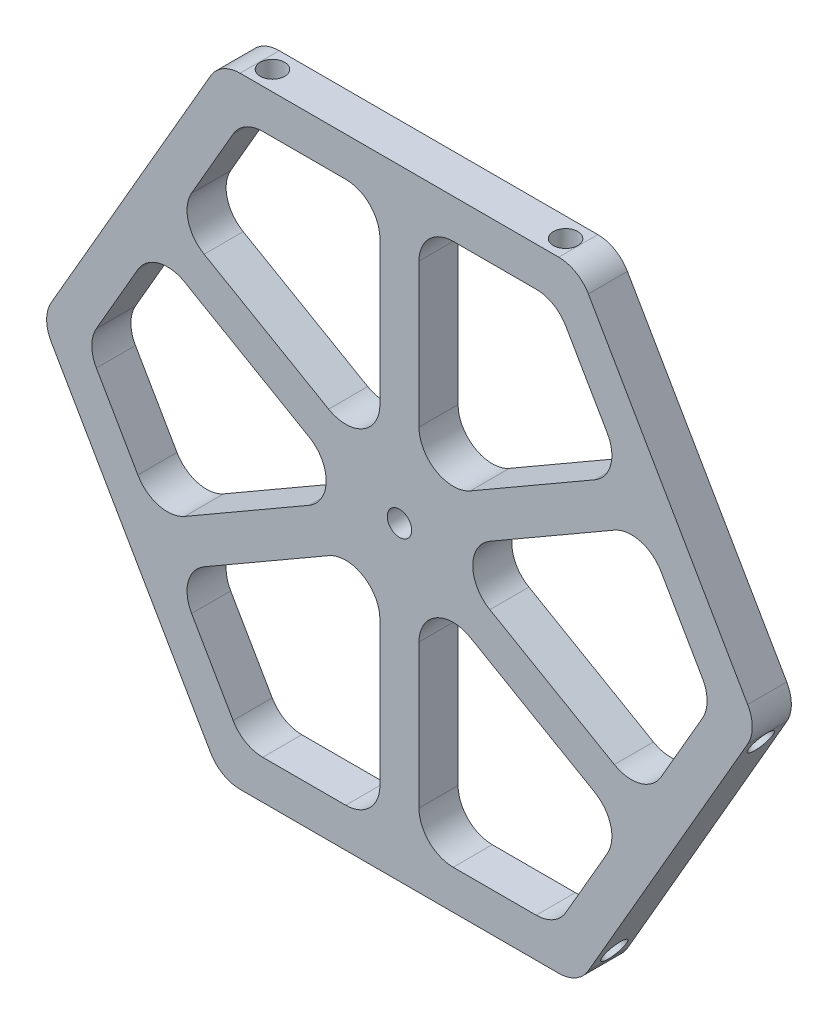
from build123d import *

# Parameters (mm, degrees)
SKETCH1_R              = 1.25
BOSS_EXTRUDE4_DEPTH    = 4
FILLET1_R              = 3.5
CUT_EXTRUDE1_START     = -31.73871501
CUT_EXTRUDE1_OUTLINE_R = 1.25
CUT_EXTRUDE1_DEPTH     = 3
CIRPATTERN1_COUNT      = 3


# Read off the part's stored shape, not the designer's step: Cut-Extrude1
with BuildPart() as part:
    # Sketch1 (on Front Plane) → Boss-Extrude4 (new body)
    with BuildSketch(Plane.XY):
        Polygon((0, 31.73871501), (-18.324355655, 31.73871501), (-27.486533482, 15.869357505), (-36.64871131, 0), (-27.486533482, -15.869357505), (-18.324355655, -31.73871501), (0, -31.73871501), (18.324355655, -31.73871501), (27.486533482, -15.869357505), (36.64871131, 0), (27.486533482, 15.869357505), (18.324355655, 31.73871501), align=None)
        Circle(SKETCH1_R, mode=Mode.SUBTRACT)
        Polygon((-2, 3.464101615), (-2, 27.73871501), (-16.014954578, 27.73871501), (-23.022431867, 15.601408313), align=None, mode=Mode.SUBTRACT)
        Polygon((-4, 0), (-25.022431867, -12.137306697), (-32.029909156, 0), (-25.022431867, 12.137306697), align=None, mode=Mode.SUBTRACT)
        Polygon((2, 27.73871501), (16.014954578, 27.73871501), (23.022431867, 15.601408313), (2, 3.464101615), align=None, mode=Mode.SUBTRACT)
        Polygon((25.022431867, 12.137306697), (32.029909156, 0), (25.022431867, -12.137306697), (4, 0), align=None, mode=Mode.SUBTRACT)
        Polygon((23.022431867, -15.601408313), (16.014954578, -27.73871501), (2, -27.73871501), (2, -3.464101615), align=None, mode=Mode.SUBTRACT)
        Polygon((-2, -3.464101615), (-2, -27.73871501), (-16.014954578, -27.73871501), (-23.022431867, -15.601408313), align=None, mode=Mode.SUBTRACT)
    extrude(amount=BOSS_EXTRUDE4_DEPTH)

    # Fillet1
    fillet1_edges = [part.edges().sort_by_distance(p)[0] for p in [
        (2, -27.73871501, 2),
        (16.014954578, -27.73871501, 2),
        (23.022431867, -15.601408313, 2),
        (2, -3.464101615, 2),
        (18.324355655, 31.73871501, 2),
        (36.64871131, 0, 2),
        (18.324355655, -31.73871501, 2),
        (-18.324355655, -31.73871501, 2),
        (-36.64871131, 0, 2),
        (-18.324355655, 31.73871501, 2),
        (23.022431867, 15.601408313, 2),
        (16.014954578, 27.73871501, 2),
        (2, 27.73871501, 2),
        (2, 3.464101615, 2),
        (-16.014954578, 27.73871501, 2),
        (-23.022431867, 15.601408313, 2),
        (-2, 3.464101615, 2),
        (-2, 27.73871501, 2),
        (-25.022431867, 12.137306697, 2),
        (-32.029909156, 0, 2),
        (-25.022431867, -12.137306697, 2),
        (-4, 0, 2),
        (25.022431867, -12.137306697, 2),
        (32.029909156, 0, 2),
        (25.022431867, 12.137306697, 2),
        (4, 0, 2),
        (-2, -3.464101615, 2),
        (-23.022431867, -15.601408313, 2),
        (-16.014954578, -27.73871501, 2),
        (-2, -27.73871501, 2),
    ]]
    fillet(fillet1_edges, radius=FILLET1_R)

    # Cut-Extrude1 outline → Cut-Extrude1 (cut)
    with BuildSketch(Plane(origin=(0, 0, 0), x_dir=(0.49999999999999195, -0.8660254037844434, 0), z_dir=(0.8660254037844433, 0.4999999999999921, 0)).offset(CUT_EXTRUDE1_START)):
        with Locations((15, -2)):
            Circle(CUT_EXTRUDE1_OUTLINE_R)
        with Locations((-15, -2)):
            Circle(CUT_EXTRUDE1_OUTLINE_R)
    cut_extrude1 = extrude(amount=CUT_EXTRUDE1_DEPTH, mode=Mode.SUBTRACT)

    # CirPattern1: Cut-Extrude1 ×3 about axis
    cirpattern1_axis = Axis((0, 0, 0), (0, 0, -1))
    for i in range(1, CIRPATTERN1_COUNT):
        add(cut_extrude1.rotate(cirpattern1_axis, i * 360 / CIRPATTERN1_COUNT), mode=Mode.SUBTRACT)


solid = part.part
